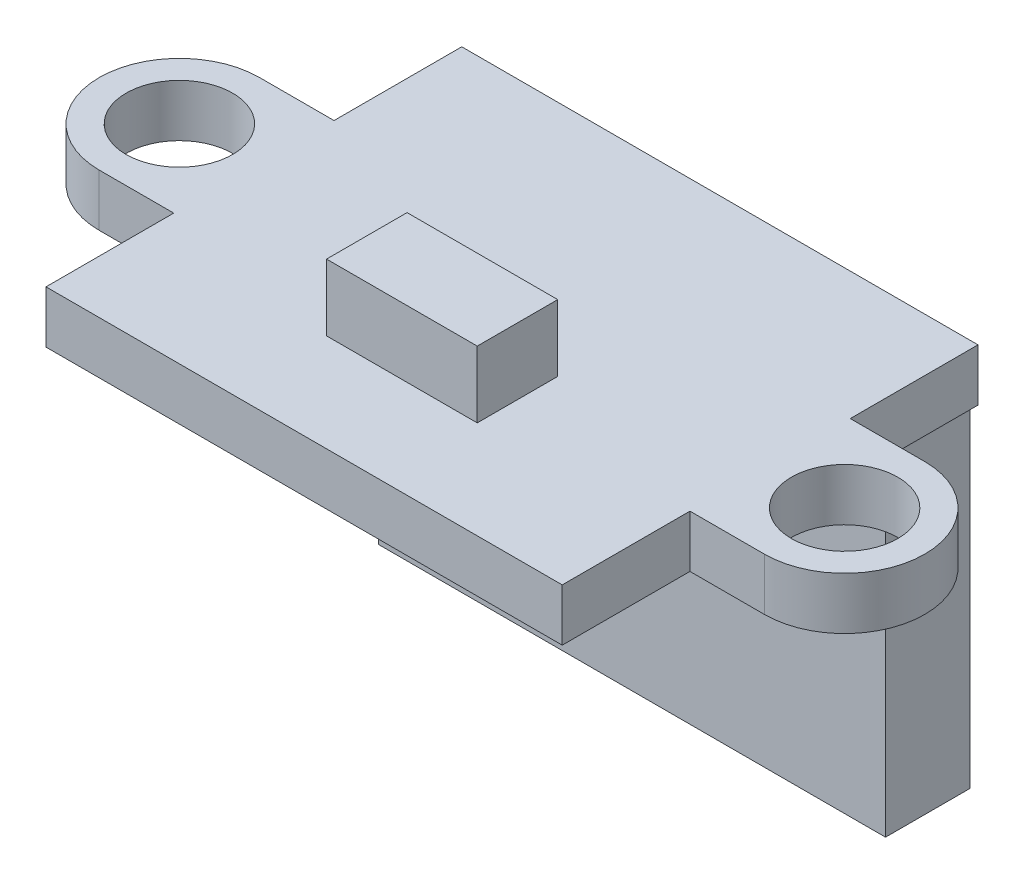
from build123d import *

# Parameters (mm, degrees)
SKETCH1_R           = 1.6
BOSS_EXTRUDE1_DEPTH = 1.57
SKETCH2_W           = 4.53
SKETCH2_H           = 2.42
BOSS_EXTRUDE2_DEPTH = 2
SKETCH3_W           = 15.24
SKETCH3_H           = 2.54
BOSS_EXTRUDE3_DEPTH = 10


with BuildPart() as part:
    # Sketch1 → Boss-Extrude1 (new body)
    with BuildSketch(Plane(origin=(0, 0, 0), x_dir=(1, 0, 0), z_dir=(0, 1, 0))):
        with BuildLine():
            Line((-7.76, -6.25), (7.76, -6.25))
            Line((7.76, -6.25), (7.76, -2.41))
            Line((7.76, -2.41), (10, -2.41))
            ThreePointArc((10, -2.41), (12.41, 0), (10, 2.41))
            Line((10, 2.41), (7.76, 2.41))
            Line((7.76, 2.41), (7.76, 6.25))
            Line((7.76, 6.25), (-7.76, 6.25))
            Line((-7.76, 6.25), (-7.76, 2.41))
            Line((-7.76, 2.41), (-10, 2.41))
            ThreePointArc((-10, 2.41), (-12.41, 0), (-10, -2.41))
            Line((-10, -2.41), (-7.76, -2.41))
            Line((-7.76, -2.41), (-7.76, -6.25))
        make_face()
        with Locations((-10, 0)):
            Circle(SKETCH1_R, mode=Mode.SUBTRACT)
        with Locations((10, 0)):
            Circle(SKETCH1_R, mode=Mode.SUBTRACT)
    extrude(amount=BOSS_EXTRUDE1_DEPTH)

    # Sketch2 → Boss-Extrude2 (add)
    with BuildSketch(Plane(origin=(0, 1.57, 0), x_dir=(1, 0, 0), z_dir=(0, 1, 0))):
        with Locations((0, -2.1)):
            Rectangle(SKETCH2_W, SKETCH2_H)
    extrude(amount=BOSS_EXTRUDE2_DEPTH)

    # Sketch3 → Boss-Extrude3 (add)
    with BuildSketch(Plane.XZ):
        with Locations((0, -4.88)):
            Rectangle(SKETCH3_W, SKETCH3_H)
    extrude(amount=BOSS_EXTRUDE3_DEPTH)


solid = part.part
